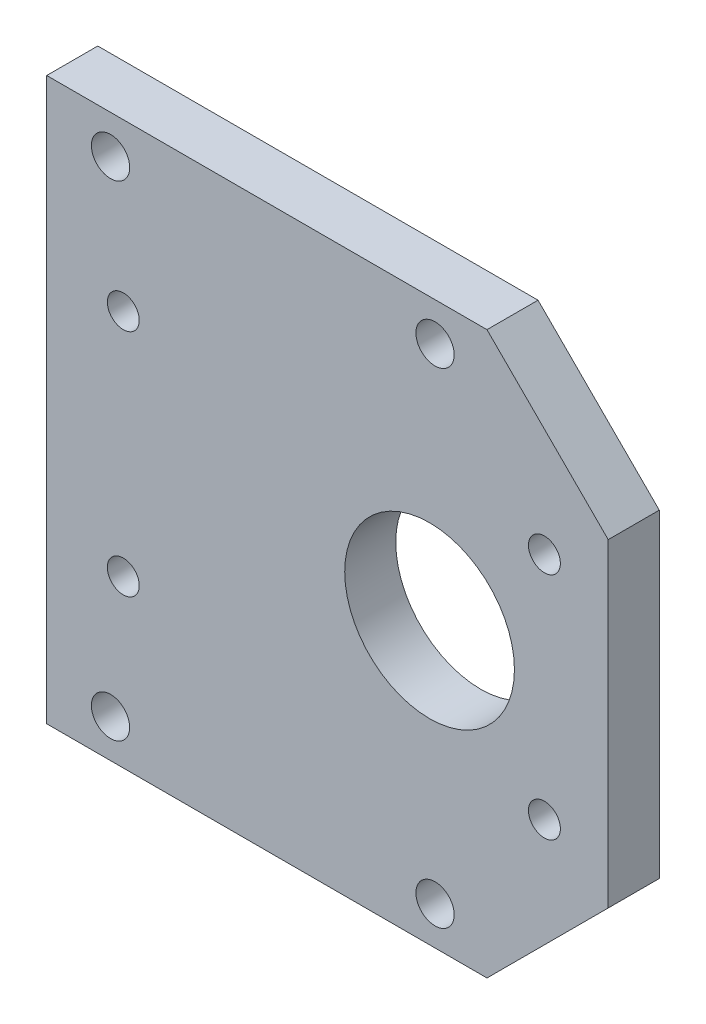
from build123d import *

# Parameters (mm, degrees)
SKETCH1_R           = 6.65
SKETCH1_R_2         = 1.25
BOSS_EXTRUDE1_DEPTH = 4
SKETCH2_R           = 1.5
CUT_EXTRUDE1_DEPTH  = 32.368774283


with BuildPart() as part:
    # Sketch1 → Boss-Extrude1 (new body)
    with BuildSketch(Plane.XY):
        Polygon((22, 12.5), (22, -12.5), (12.5, -22), (-22, -22), (-22, 22), (12.5, 22), align=None)
        with Locations((8, 0)):
            Circle(SKETCH1_R, mode=Mode.SUBTRACT)
        with Locations((17, 9)):
            Circle(SKETCH1_R_2, mode=Mode.SUBTRACT)
        with Locations((17, -9)):
            Circle(SKETCH1_R_2, mode=Mode.SUBTRACT)
        with Locations((-16, 9)):
            Circle(SKETCH1_R_2, mode=Mode.SUBTRACT)
        with Locations((-16, -9)):
            Circle(SKETCH1_R_2, mode=Mode.SUBTRACT)
    extrude(amount=BOSS_EXTRUDE1_DEPTH)

    # Sketch2 → Cut-Extrude1 (cut, through all)
    with BuildSketch(Plane.XY.offset(4)):
        with Locations((-17, -19)):
            Circle(SKETCH2_R)
        with Locations((8.428932188, -19)):
            Circle(SKETCH2_R)
        with Locations((-17, 19)):
            Circle(SKETCH2_R)
        with Locations((8.428932188, 19)):
            Circle(SKETCH2_R)
    extrude(amount=-CUT_EXTRUDE1_DEPTH, mode=Mode.SUBTRACT)


solid = part.part
